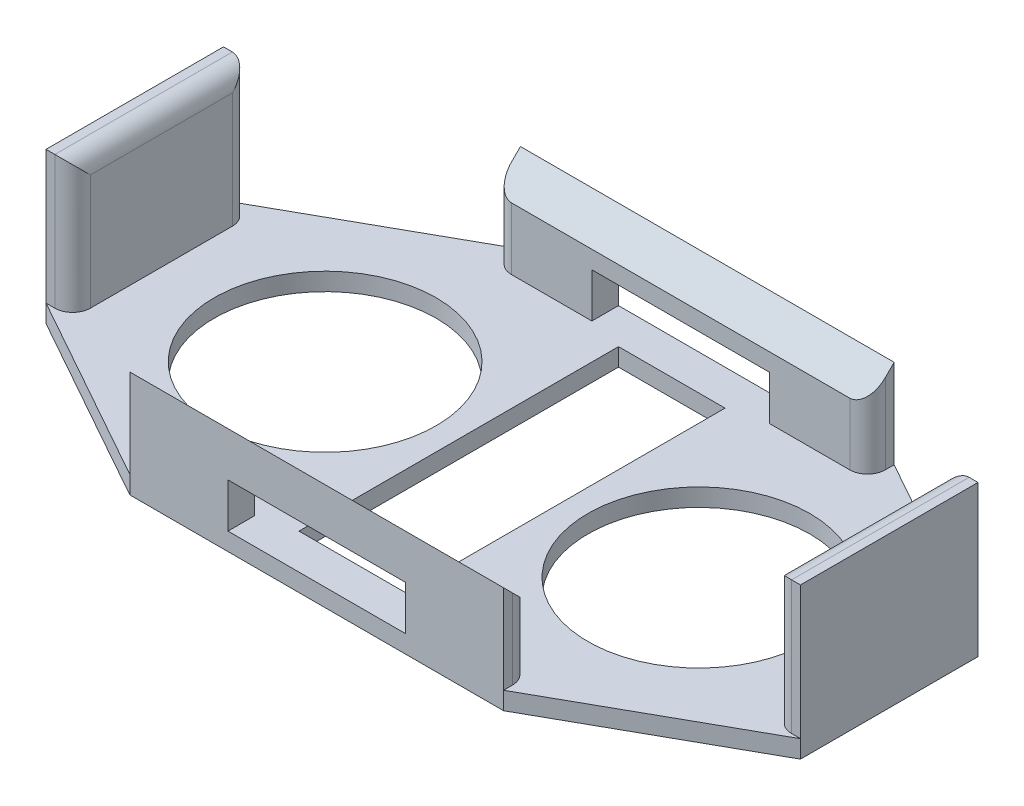
from build123d import *

# Parameters (mm, degrees)
SKETCH1_W           = 85
SKETCH1_H           = 44
BOSS_EXTRUDE1_DEPTH = 2
SKETCH2_W           = 3
SKETCH2_H           = 20
BOSS_EXTRUDE2_DEPTH = 15
SKETCH3_W           = 42.103313086
SKETCH3_H           = 3
BOSS_EXTRUDE3_DEPTH = 10
SKETCH4_W           = 20
SKETCH4_H           = 5
CUT_EXTRUDE1_DEPTH  = 99.208960895
CHAMFER1_SIZE       = 3
FILLET1_R           = 2
SKETCH6_OUTSIDE_W   = 106.442
SKETCH6_OUTSIDE_H   = 65.442
SKETCH6_OUTSIDE_R   = 12.5
SKETCH6_OUTSIDE_W_2 = 12
SKETCH6_OUTSIDE_H_2 = 36
CUT_EXTRUDE3_DEPTH  = 2


with BuildPart() as part:
    # Sketch1 → Boss-Extrude1 (new body)
    with BuildSketch(Plane(origin=(0, 5, 0), x_dir=(1, 0, 0), z_dir=(0, 1, 0))):
        with Locations((42.5, 22)):
            Rectangle(SKETCH1_W, SKETCH1_H)
    extrude(amount=BOSS_EXTRUDE1_DEPTH)

    # Sketch2 → Boss-Extrude2 (add)
    with BuildSketch(Plane(origin=(0, 7, 0), x_dir=(1, 0, 0), z_dir=(0, 1, 0))):
        with Locations((1.5, 22)):
            Rectangle(SKETCH2_W, SKETCH2_H)
        with Locations((83.5, 22)):
            Rectangle(SKETCH2_W, SKETCH2_H)
    extrude(amount=BOSS_EXTRUDE2_DEPTH)

    # Sketch3 → Boss-Extrude3 (add)
    with BuildSketch(Plane(origin=(0, 7, 0), x_dir=(1, 0, 0), z_dir=(0, 1, 0))):
        with Locations((42.5, 42.5)):
            Rectangle(SKETCH3_W, SKETCH3_H)
        with Locations((42.5, 1.5)):
            Rectangle(SKETCH3_W, SKETCH3_H)
    extrude(amount=BOSS_EXTRUDE3_DEPTH)

    # Sketch4 → Cut-Extrude1 (cut, through all)
    with BuildSketch(Plane.XY):
        with Locations((42.5, 9.5)):
            Rectangle(SKETCH4_W, SKETCH4_H)
    extrude(amount=-CUT_EXTRUDE1_DEPTH, mode=Mode.SUBTRACT)

    # Chamfer1
    chamfer1_edges = [part.edges().sort_by_distance(p)[0] for p in [
        (42.5, 17, -3),
        (42.5, 17, -41),
    ]]
    chamfer(chamfer1_edges, length=CHAMFER1_SIZE - 0.0001)  # a hair under: the kernel refuses the full size

    # Fillet1
    fillet1_edges = [part.edges().sort_by_distance(p)[0] for p in [
        (3, 14.5, -12),
        (3, 14.5, -32),
        (3, 22, -22),
        (82, 14.5, -32),
        (82, 14.5, -12),
        (82, 22, -22),
        (0, 6, -44),
        (85, 6, -44),
        (85, 6, 0),
        (0, 6, 0),
        (21.448343457, 10.50005, -3),
        (63.551656543, 10.50005, -3),
        (63.551656543, 10.50005, -41),
        (21.448343457, 10.50005, -41),
    ]]
    fillet(fillet1_edges, radius=FILLET1_R)

    # Sketch6 outside → Cut-Extrude3 (cut)
    # profile 1 of 4: a face of its own
    with BuildSketch(Plane(origin=(0, 5, 0), x_dir=(1, 0, 0), z_dir=(0, 1, 0))):
        with Locations((42.5, 22)):
            Rectangle(SKETCH6_OUTSIDE_W, SKETCH6_OUTSIDE_H)
        Polygon((0, 32), (21.448343457, 44), (63.551656543, 44), (85, 32), (85, 12), (63.551656543, 0), (21.448343457, 0), (0, 12), align=None, mode=Mode.SUBTRACT)
    # profile 2 of 4: a face of its own
    with BuildSketch(Plane(origin=(0, 5, 0), x_dir=(1, 0, 0), z_dir=(0, 1, 0))):
        with Locations(Location((21.448343457, 22, 0), (0, 0, 90))):
            Circle(SKETCH6_OUTSIDE_R)
    # profile 3 of 4: a face of its own
    with BuildSketch(Plane(origin=(0, 5, 0), x_dir=(1, 0, 0), z_dir=(0, 1, 0))):
        with Locations(Location((63.551656543, 22, 0), (0, 0, 90))):
            Circle(SKETCH6_OUTSIDE_R)
    # profile 4 of 4: a face of its own
    with BuildSketch(Plane(origin=(0, 5, 0), x_dir=(1, 0, 0), z_dir=(0, 1, 0))):
        with Locations((42.5, 22)):
            Rectangle(SKETCH6_OUTSIDE_W_2, SKETCH6_OUTSIDE_H_2)
    extrude(amount=CUT_EXTRUDE3_DEPTH, mode=Mode.SUBTRACT)


solid = part.part
